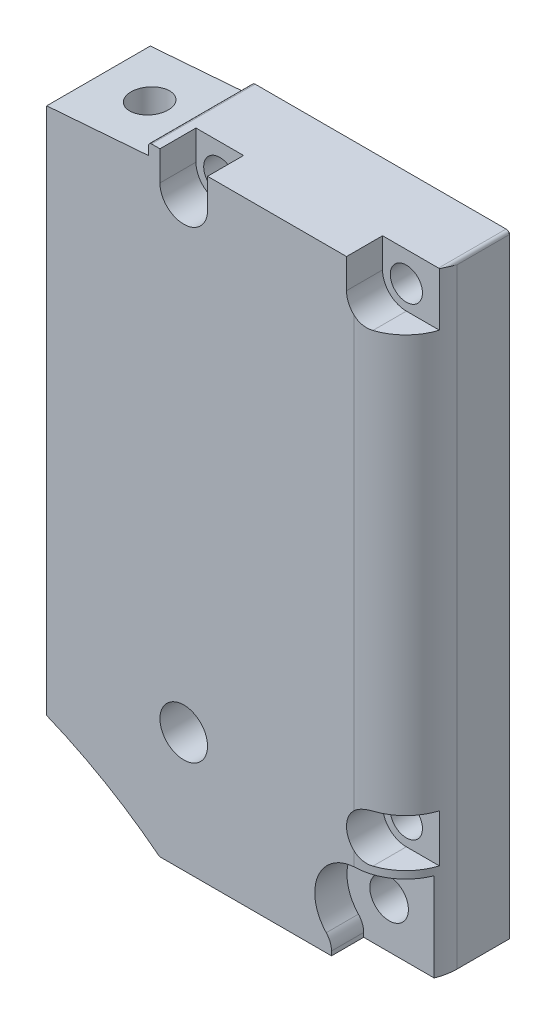
from build123d import *

# Parameters (mm, degrees)
SKETCH2_W                 = 20
SKETCH2_H                 = 40.65
BOSS_EXTRUDE2_DEPTH       = 7.05
SKETCH3_W                 = 18.2
SKETCH3_H                 = 38.65
BOSS_EXTRUDE3_DEPTH       = 0.9
CUT_EXTRUDE1_DEPTH        = 7
CUT_EXTRUDE4_REACH        = 40.342
SKETCH4_4_R               = 1.25
BOSS_EXTRUDE4_START       = 1
BOSS_EXTRUDE4_DEPTH       = 1
CUT_EXTRUDE5_START        = -1.8
SKETCH5_R                 = 1.85
SKETCH5_R_2               = 1.25
CUT_EXTRUDE5_DEPTH        = 1.8
CUT_EXTRUDE6_DEPTH        = 7.05
CUT_EXTRUDE7_REACH        = 161.774
SKETCH8_W                 = 5
SKETCH8_H                 = 4.55
SKETCH9_R                 = 1.85
BOSS_EXTRUDE5_DEPTH       = 1
BOSS_EXTRUDE7_DEPTH       = 8.05
CUT_EXTRUDE8_START        = -7
SKETCH12_W                = 8.257782219
SKETCH12_H                = 4.906896877
CUT_EXTRUDE8_DEPTH        = 7
CUT_EXTRUDE9_DEPTH        = 2.5
CUT_EXTRUDE10_START       = -8.05
SKETCH13_3_R              = 1.499999995
CUT_EXTRUDE10_DEPTH       = 5.55
CUT_EXTRUDE11_START       = 3.965472269
CUT_EXTRUDE11_DEPTH       = 15.412425263
CUT_EXTRUDE11_START_2     = -3.484925616
CUT_EXTRUDE11_2_OUTLINE_W = 6
CUT_EXTRUDE11_2_OUTLINE_H = 6
CUT_EXTRUDE11_2_DEPTH     = 1.484925616
FILLET1_START             = -28
FILLET1_DEPTH             = 48.269968213
FILLET2_R                 = 1.5


with BuildPart() as part:
    # Sketch2 → Boss-Extrude2 (new body)
    with BuildSketch(Plane.XY.offset(150.825691762)):
        with Locations((21.495324698, -0.04622899)):
            Rectangle(SKETCH2_W, SKETCH2_H)
    extrude(amount=-BOSS_EXTRUDE2_DEPTH)

    # Sketch3 → Boss-Extrude3 (add)
    with BuildSketch(Plane.XY.offset(150.825691762)):
        with Locations((21.495324698, -0.04622899)):
            Rectangle(SKETCH3_W, SKETCH3_H)
    extrude(amount=BOSS_EXTRUDE3_DEPTH)

    # Sketch4 → Cut-Extrude1 (cut)
    with BuildSketch(Plane.XY.offset(151.725691762)):
        with BuildLine():
            Line((29.995324698, -15.734564701), (29.995324698, 7.977115044))
            ThreePointArc((29.995324698, 7.977115044), (21.495324698, 1.30377101), (12.995324698, 7.977115044))
            Line((12.995324698, 7.977115044), (12.995324698, -15.734564701))
            ThreePointArc((12.995324698, -15.734564701), (15.847276575, -15.960245764), (16.832190562, -18.64622899))
            Line((16.832190562, -18.64622899), (26.158458833, -18.64622899))
            ThreePointArc((26.158458833, -18.64622899), (27.14337282, -15.960245764), (29.995324698, -15.734564701))
        make_face()
        with BuildLine():
            Line((29.995324698, 7.977115044), (29.995324698, 12.130426976))
            ThreePointArc((29.995324698, 12.130426976), (27.682509033, 16.240955345), (23.571980663, 18.55377101))
            Line((23.571980663, 18.55377101), (19.418668732, 18.55377101))
            ThreePointArc((19.418668732, 18.55377101), (15.308140362, 16.240955345), (12.995324698, 12.130426976))
            Line((12.995324698, 12.130426976), (12.995324698, 7.977115044))
            ThreePointArc((12.995324698, 7.977115044), (21.495324698, 1.30377101), (29.995324698, 7.977115044))
        make_face()
        with BuildLine():
            ThreePointArc((12.995324698, 12.130426976), (15.308140362, 16.240955345), (19.418668732, 18.55377101))
            Line((19.418668732, 18.55377101), (18.693093444, 18.55377101))
            ThreePointArc((18.693093444, 18.55377101), (15.166719006, 16.382376702), (12.995324698, 12.856002264))
            Line((12.995324698, 12.856002264), (12.995324698, 12.130426976))
        make_face()
        with BuildLine():
            Line((19.418668732, 18.55377101), (23.571980663, 18.55377101))
            ThreePointArc((23.571980663, 18.55377101), (21.495324698, 18.80377101), (19.418668732, 18.55377101))
        make_face()
        with BuildLine():
            Line((29.995324698, 12.130426976), (29.995324698, 12.856002264))
            ThreePointArc((29.995324698, 12.856002264), (27.823930389, 16.382376702), (24.297555951, 18.55377101))
            Line((24.297555951, 18.55377101), (23.571980663, 18.55377101))
            ThreePointArc((23.571980663, 18.55377101), (27.682509033, 16.240955345), (29.995324698, 12.130426976))
        make_face()
        with BuildLine():
            ThreePointArc((12.995324698, 12.130426976), (12.745324698, 10.05377101), (12.995324698, 7.977115044))
            Line((12.995324698, 7.977115044), (12.995324698, 12.130426976))
        make_face()
        with BuildLine():
            ThreePointArc((30.245324698, 10.05377101), (30.182599875, 11.099596043), (29.995324698, 12.130426976))
            Line((29.995324698, 12.130426976), (29.995324698, 7.977115044))
            ThreePointArc((29.995324698, 7.977115044), (30.182599875, 9.007945977), (30.245324698, 10.05377101))
        make_face()
    extrude(amount=-CUT_EXTRUDE1_DEPTH, mode=Mode.SUBTRACT)

    # Sketch4<4> → Cut-Extrude4 (cut, up to next)
    with BuildSketch(Plane.XY.offset(151.725691762), mode=Mode.PRIVATE) as cut_extrude4_sk1:
        with BuildLine():
            ThreePointArc((29.855223342, -18.64622899), (29.959794398, -18.367140037), (29.995324698, -18.07122899))
            ThreePointArc((29.995324698, -18.07122899), (28.449413651, -16.85675929), (27.635426054, -18.64622899))
            Line((27.635426054, -18.64622899), (29.855223342, -18.64622899))
        make_face()
    cut_extrude4_tool1 = extrude(cut_extrude4_sk1.sketch, amount=-CUT_EXTRUDE4_REACH, mode=Mode.PRIVATE) & part.part
    # Sketch4<4> → Cut-Extrude4 (cut, up to next)
    with BuildSketch(Plane.XY.offset(151.725691762), mode=Mode.PRIVATE) as cut_extrude4_sk2:
        with BuildLine():
            Line((29.855223342, -18.64622899), (27.635426054, -18.64622899))
            ThreePointArc((27.635426054, -18.64622899), (28.745324698, -19.32122899), (29.855223342, -18.64622899))
        make_face()
    cut_extrude4_tool2 = extrude(cut_extrude4_sk2.sketch, amount=-CUT_EXTRUDE4_REACH, mode=Mode.PRIVATE) & part.part
    # Sketch4<4> → Cut-Extrude4 (cut, up to next)
    with BuildSketch(Plane.XY.offset(151.725691762), mode=Mode.PRIVATE) as cut_extrude4_sk3:
        with BuildLine():
            ThreePointArc((29.855223342, -18.64622899), (29.959794398, -18.367140037), (29.995324698, -18.07122899))
            ThreePointArc((29.995324698, -18.07122899), (28.449413651, -16.85675929), (27.635426054, -18.64622899))
            Line((27.635426054, -18.64622899), (29.855223342, -18.64622899))
        make_face()
    cut_extrude4_tool3 = extrude(cut_extrude4_sk3.sketch, amount=-CUT_EXTRUDE4_REACH, mode=Mode.PRIVATE) & part.part
    # Sketch4<4> → Cut-Extrude4 (cut, up to next)
    with BuildSketch(Plane.XY.offset(151.725691762), mode=Mode.PRIVATE) as cut_extrude4_sk4:
        with BuildLine():
            Line((29.855223342, -18.64622899), (27.635426054, -18.64622899))
            ThreePointArc((27.635426054, -18.64622899), (28.745324698, -19.32122899), (29.855223342, -18.64622899))
        make_face()
    cut_extrude4_tool4 = extrude(cut_extrude4_sk4.sketch, amount=-CUT_EXTRUDE4_REACH, mode=Mode.PRIVATE) & part.part
    # Sketch4<4> → Cut-Extrude4 (cut, up to next)
    with BuildSketch(Plane.XY.offset(151.725691762), mode=Mode.PRIVATE) as cut_extrude4_sk5:
        with Locations((14.245324698, -18.07122899)):
            Circle(SKETCH4_4_R)
    cut_extrude4_tool5 = extrude(cut_extrude4_sk5.sketch, amount=-CUT_EXTRUDE4_REACH, mode=Mode.PRIVATE) & part.part
    # Sketch4<4> → Cut-Extrude4 (cut, up to next)
    with BuildSketch(Plane.XY.offset(151.725691762), mode=Mode.PRIVATE) as cut_extrude4_sk6:
        with Locations((28.745324698, 17.97877101)):
            Circle(SKETCH4_4_R)
    cut_extrude4_tool6 = extrude(cut_extrude4_sk6.sketch, amount=-CUT_EXTRUDE4_REACH, mode=Mode.PRIVATE) & part.part
    # Sketch4<4> → Cut-Extrude4 (cut, up to next)
    with BuildSketch(Plane.XY.offset(151.725691762), mode=Mode.PRIVATE) as cut_extrude4_sk7:
        with Locations((14.245324698, 17.97877101)):
            Circle(SKETCH4_4_R)
    cut_extrude4_tool7 = extrude(cut_extrude4_sk7.sketch, amount=-CUT_EXTRUDE4_REACH, mode=Mode.PRIVATE) & part.part
    add(cut_extrude4_tool1.solids().sort_by_distance((28.745325, -17.833823, 151.725692))[0], mode=Mode.SUBTRACT)
    add(cut_extrude4_tool2.solids().sort_by_distance((28.745325, -18.923652, 151.725692))[0], mode=Mode.SUBTRACT)
    add(cut_extrude4_tool3.solids().sort_by_distance((28.745325, -17.833823, 151.725692))[0], mode=Mode.SUBTRACT)
    add(cut_extrude4_tool4.solids().sort_by_distance((28.745325, -18.923652, 151.725692))[0], mode=Mode.SUBTRACT)
    add(cut_extrude4_tool5.solids().sort_by_distance((14.245325, -18.071229, 151.725692))[0], mode=Mode.SUBTRACT)
    add(cut_extrude4_tool6.solids().sort_by_distance((28.745325, 17.978771, 151.725692))[0], mode=Mode.SUBTRACT)
    add(cut_extrude4_tool7.solids().sort_by_distance((14.245325, 17.978771, 151.725692))[0], mode=Mode.SUBTRACT)

    # Sketch6 → Boss-Extrude4 (add)
    with BuildSketch(Plane.XY.offset(144.725691762).offset(BOSS_EXTRUDE4_START)):
        with BuildLine():
            ThreePointArc((13.658334388, 14.376279875), (16.709025437, 15.285691236), (17.885705242, 18.243590751))
            ThreePointArc((17.885705242, 18.243590751), (15.454195488, 16.657350181), (13.658334388, 14.376279875))
        make_face()
        with BuildLine():
            ThreePointArc((17.849749062, -18.64622899), (16.56791041, -15.255541577), (12.995324698, -14.64194335))
            Line((12.995324698, -14.64194335), (12.995324698, -15.734564701))
            ThreePointArc((12.995324698, -15.734564701), (15.847276575, -15.960245764), (16.832190562, -18.64622899))
            Line((16.832190562, -18.64622899), (17.849749062, -18.64622899))
        make_face()
        with BuildLine():
            ThreePointArc((29.332315007, 14.376279875), (27.536453908, 16.657350181), (25.104944154, 18.243590751))
            ThreePointArc((25.104944154, 18.243590751), (26.281623958, 15.285691236), (29.332315007, 14.376279875))
        make_face()
        with BuildLine():
            ThreePointArc((29.995324698, -14.64194335), (26.422738985, -15.255541577), (25.140900333, -18.64622899))
            Line((25.140900333, -18.64622899), (26.158458833, -18.64622899))
            ThreePointArc((26.158458833, -18.64622899), (27.14337282, -15.960245764), (29.995324698, -15.734564701))
            Line((29.995324698, -15.734564701), (29.995324698, -14.64194335))
        make_face()
    extrude(amount=-BOSS_EXTRUDE4_DEPTH)

    # Sketch5 → Cut-Extrude5 (cut)
    # profile 1 of 7: a face of its own
    with BuildSketch(Plane(origin=(0, 0, 143.775691762), x_dir=(-1, 0, 0), z_dir=(0, 0, -1)).offset(CUT_EXTRUDE5_START)):
        with BuildLine():
            Line((-31.495324698, 16.12877101), (-28.745324698, 16.12877101))
            ThreePointArc((-28.745324698, 16.12877101), (-30.053472243, 19.286918555), (-26.895324698, 17.97877101))
            Line((-26.895324698, 17.97877101), (-26.895324698, 20.27877101))
            Line((-26.895324698, 20.27877101), (-31.495324698, 20.27877101))
            Line((-31.495324698, 20.27877101), (-31.495324698, 16.12877101))
        make_face()
    # profile 2 of 7: a face of its own
    with BuildSketch(Plane(origin=(0, 0, 143.775691762), x_dir=(-1, 0, 0), z_dir=(0, 0, -1)).offset(CUT_EXTRUDE5_START)):
        with Locations((-28.745324698, 17.97877101)):
            Circle(SKETCH5_R)
        with Locations(Location((-28.745324698, 17.97877101, 0), (0, 0, 180))):
            Circle(SKETCH5_R_2, mode=Mode.SUBTRACT)
    # profile 3 of 7: a face of its own
    with BuildSketch(Plane(origin=(0, 0, 143.775691762), x_dir=(-1, 0, 0), z_dir=(0, 0, -1)).offset(CUT_EXTRUDE5_START)):
        with BuildLine():
            Line((-12.395324698, 20.27877101), (-16.095324698, 20.27877101))
            Line((-16.095324698, 20.27877101), (-16.095324698, 17.97877101))
            ThreePointArc((-16.095324698, 17.97877101), (-14.245324698, 19.82877101), (-12.395324698, 17.97877101))
            Line((-12.395324698, 17.97877101), (-12.395324698, 20.27877101))
        make_face()
    # profile 4 of 7: a face of its own
    with BuildSketch(Plane(origin=(0, 0, 143.775691762), x_dir=(-1, 0, 0), z_dir=(0, 0, -1)).offset(CUT_EXTRUDE5_START)):
        with Locations((-14.245324698, 17.97877101)):
            Circle(SKETCH5_R)
        with Locations(Location((-14.245324698, 17.97877101, 0), (0, 0, 180))):
            Circle(SKETCH5_R_2, mode=Mode.SUBTRACT)
    # profile 5 of 7: a face of its own
    with BuildSketch(Plane(origin=(0, 0, 143.775691762), x_dir=(-1, 0, 0), z_dir=(0, 0, -1)).offset(CUT_EXTRUDE5_START)):
        with BuildLine():
            Line((-28.745324698, -16.22122899), (-31.495324698, -16.22122899))
            Line((-31.495324698, -16.22122899), (-31.495324698, -19.92122899))
            Line((-31.495324698, -19.92122899), (-28.745324698, -19.92122899))
            ThreePointArc((-28.745324698, -19.92122899), (-30.595324698, -18.07122899), (-28.745324698, -16.22122899))
        make_face()
    # profile 6 of 7: a face of its own
    with BuildSketch(Plane(origin=(0, 0, 143.775691762), x_dir=(-1, 0, 0), z_dir=(0, 0, -1)).offset(CUT_EXTRUDE5_START)):
        with Locations((-28.745324698, -18.07122899)):
            Circle(SKETCH5_R)
        with Locations(Location((-28.745324698, -18.07122899, 0), (0, 0, 180))):
            Circle(SKETCH5_R_2, mode=Mode.SUBTRACT)
    # profile 7 of 7: a face of its own
    with BuildSketch(Plane(origin=(0, 0, 143.775691762), x_dir=(-1, 0, 0), z_dir=(0, 0, -1)).offset(CUT_EXTRUDE5_START)):
        with Locations((-14.245324698, -18.07122899)):
            Circle(SKETCH5_R)
        with Locations(Location((-14.245324698, -18.07122899, 0), (0, 0, 180))):
            Circle(SKETCH5_R_2, mode=Mode.SUBTRACT)
    extrude(amount=CUT_EXTRUDE5_DEPTH, mode=Mode.SUBTRACT)

    # Sketch7 → Cut-Extrude6 (cut)
    with BuildSketch(Plane(origin=(0, 0, 143.775691762), x_dir=(-1, 0, 0), z_dir=(0, 0, -1))):
        with BuildLine():
            Line((-31.495324698, -20.37122899), (-31.245324698, -20.37122899))
            ThreePointArc((-31.245324698, -20.37122899), (-31.422101393, -20.298005685), (-31.495324698, -20.12122899))
            Line((-31.495324698, -20.12122899), (-31.495324698, -20.37122899))
        make_face()
        with BuildLine():
            Line((-11.745324698, -20.37122899), (-11.495324698, -20.37122899))
            Line((-11.495324698, -20.37122899), (-11.495324698, -20.12122899))
            ThreePointArc((-11.495324698, -20.12122899), (-11.568548002, -20.298005685), (-11.745324698, -20.37122899))
        make_face()
        with BuildLine():
            ThreePointArc((-11.745324698, 20.27877101), (-11.568548002, 20.205547705), (-11.495324698, 20.02877101))
            Line((-11.495324698, 20.02877101), (-11.495324698, 20.27877101))
            Line((-11.495324698, 20.27877101), (-11.745324698, 20.27877101))
        make_face()
        with BuildLine():
            ThreePointArc((-31.245324698, 20.27877101), (-31.422101393, 20.205547705), (-31.495324698, 20.02877101))
            Line((-31.495324698, 20.02877101), (-31.495324698, 20.27877101))
            Line((-31.495324698, 20.27877101), (-31.245324698, 20.27877101))
        make_face()
    extrude(amount=-CUT_EXTRUDE6_DEPTH, mode=Mode.SUBTRACT)

    # Sketch8 → Cut-Extrude7 (cut, up to next)
    with BuildSketch(Plane(origin=(0, -18.64622899, 0), x_dir=(1, 0, 0), z_dir=(0, 1, 0)), mode=Mode.PRIVATE) as cut_extrude7_sk1:
        with Locations((21.495324698, -149.450691762)):
            Rectangle(SKETCH8_W, SKETCH8_H)
    cut_extrude7_tool1 = extrude(cut_extrude7_sk1.sketch, amount=-CUT_EXTRUDE7_REACH, mode=Mode.PRIVATE) & part.part
    add(cut_extrude7_tool1.solids().sort_by_distance((21.495325, -18.646229, 149.450692))[0], mode=Mode.SUBTRACT)

    # Sketch9 → Boss-Extrude5 (add)
    with BuildSketch(Plane(origin=(0, 0, 143.775691762), x_dir=(-1, 0, 0), z_dir=(0, 0, -1))):
        with BuildLine():
            ThreePointArc((-11.745324698, -20.37122899), (-11.568548002, -20.298005685), (-11.495324698, -20.12122899))
            Line((-11.495324698, -20.12122899), (-11.495324698, 20.02877101))
            ThreePointArc((-11.495324698, 20.02877101), (-11.568548002, 20.205547705), (-11.745324698, 20.27877101))
            Line((-11.745324698, 20.27877101), (-12.395324698, 20.27877101))
            Line((-12.395324698, 20.27877101), (-12.395324698, 17.97877101))
            ThreePointArc((-12.395324698, 17.97877101), (-14.245324698, 16.12877101), (-16.095324698, 17.97877101))
            Line((-16.095324698, 17.97877101), (-16.095324698, 20.27877101))
            Line((-16.095324698, 20.27877101), (-26.895324698, 20.27877101))
            Line((-26.895324698, 20.27877101), (-26.895324698, 17.97877101))
            ThreePointArc((-26.895324698, 17.97877101), (-27.437177152, 16.670623465), (-28.745324698, 16.12877101))
            Line((-28.745324698, 16.12877101), (-31.495324698, 16.12877101))
            Line((-31.495324698, 16.12877101), (-31.495324698, -16.22122899))
            Line((-31.495324698, -16.22122899), (-28.745324698, -16.22122899))
            ThreePointArc((-28.745324698, -16.22122899), (-26.895324698, -18.07122899), (-28.745324698, -19.92122899))
            Line((-28.745324698, -19.92122899), (-31.495324698, -19.92122899))
            Line((-31.495324698, -19.92122899), (-31.495324698, -20.12122899))
            ThreePointArc((-31.495324698, -20.12122899), (-31.422101393, -20.298005685), (-31.245324698, -20.37122899))
            Line((-31.245324698, -20.37122899), (-11.745324698, -20.37122899))
        make_face()
        with Locations((-14.245324698, -18.07122899)):
            Circle(SKETCH9_R, mode=Mode.SUBTRACT)
    extrude(amount=BOSS_EXTRUDE5_DEPTH)

    # Sketch11 → Boss-Extrude7 (add)
    with BuildSketch(Plane(origin=(0, 0, 142.775691762), x_dir=(-1, 0, 0), z_dir=(0, 0, -1))):
        with BuildLine():
            ThreePointArc((-12.363529237, -27.37122899), (-11.931858956, -27.037692554), (-11.495324698, -26.710547897))
            Line((-11.495324698, -26.710547897), (-11.495324698, -20.12122899))
            ThreePointArc((-11.495324698, -20.12122899), (-11.568548002, -20.298005685), (-11.745324698, -20.37122899))
            Line((-11.745324698, -20.37122899), (-31.245324698, -20.37122899))
            ThreePointArc((-31.245324698, -20.37122899), (-31.422101393, -20.298005685), (-31.495324698, -20.12122899))
            Line((-31.495324698, -20.12122899), (-31.495324698, -27.37122899))
            Line((-31.495324698, -27.37122899), (-12.363529237, -27.37122899))
        make_face()
        with BuildLine():
            ThreePointArc((-11.495324698, -26.710547897), (-7.682005328, -24.242455478), (-3.595324698, -22.259546951))
            Line((-3.595324698, -22.259546951), (-3.595324698, 18.771265769))
            Line((-3.595324698, 18.771265769), (-11.495324698, 19.377897532))
            Line((-11.495324698, 19.377897532), (-11.495324698, -20.12122899))
            Line((-11.495324698, -20.12122899), (-11.495324698, -26.710547897))
        make_face()
    extrude(amount=-BOSS_EXTRUDE7_DEPTH)

    # Sketch12 → Cut-Extrude8 (cut)
    with BuildSketch(Plane.XZ.offset(27.37122899).offset(CUT_EXTRUDE8_START)):
        with Locations((21.495324698, 148.372243324)):
            Rectangle(SKETCH12_W, SKETCH12_H)
    extrude(amount=CUT_EXTRUDE8_DEPTH, mode=Mode.SUBTRACT)

    # Sketch13 → Cut-Extrude9 (cut)
    with BuildSketch(Plane(origin=(0, 0, 142.775691762), x_dir=(-1, 0, 0), z_dir=(0, 0, -1))):
        with BuildLine():
            Line((-25.728428709, -27.37122899), (-25.728428709, -26.381755197))
            ThreePointArc((-25.728428712, -26.381755192), (-24.598475851, -22.727703268), (-27.703428709, -20.494285107))
            Line((-27.703428709, -20.494285101), (-31.495324698, -20.494285101))
            Line((-31.495324698, -20.494285101), (-31.495324698, -27.37122899))
            Line((-31.495324698, -27.37122899), (-25.728428709, -27.37122899))
        make_face()
    extrude(amount=-CUT_EXTRUDE9_DEPTH, mode=Mode.SUBTRACT)

    # Sketch13<3> → Cut-Extrude10 (cut)
    with BuildSketch(Plane(origin=(0, 0, 142.775691762), x_dir=(-1, 0, 0), z_dir=(0, 0, -1)).offset(CUT_EXTRUDE10_START)):
        with Locations((-27.703428709, -23.769285101)):
            Circle(SKETCH13_3_R)
    extrude(amount=CUT_EXTRUDE10_DEPTH, mode=Mode.SUBTRACT)

    # Cut-Extrude11: read off the stored shape, not the designer's step
    # Cut-Extrude11 outline → Cut-Extrude11 (cut)
    with BuildSketch(Plane(origin=(0, 0, 0), x_dir=(1, 0, 0), z_dir=(0, 1, 0)).offset(CUT_EXTRUDE11_START)):
        with BuildLine():
            add(Edge.make_bspline(
                [(6.124424281, -146.800691762), (6.124424281, -149.312165433), (8.293040031, -148.056428598), (10.46165578, -146.800691762), (8.293040031, -145.544954927), (6.124424281, -144.289218091), (6.124424281, -146.800691762)],
                knots=[0, 0, 0, 2.094395102, 2.094395102, 4.188790205, 4.188790205, 6.283185307, 6.283185307, 6.283185307], degree=2, weights=[1, 0.5, 1, 0.5, 1, 0.5, 1]))
        make_face()
    extrude(amount=CUT_EXTRUDE11_DEPTH, mode=Mode.SUBTRACT)

    # Cut-Extrude11 2 outline → Cut-Extrude11 2 (add)
    with BuildSketch(Plane(origin=(0, 0, 0), x_dir=(0.997064712375443, 0.07656343341096303, 0), z_dir=(0.07656343341096301, -0.9970647123754431, 0)).offset(CUT_EXTRUDE11_START_2)):
        with Locations((8, 147)):
            Rectangle(CUT_EXTRUDE11_2_OUTLINE_W, CUT_EXTRUDE11_2_OUTLINE_H)
    extrude(amount=CUT_EXTRUDE11_2_DEPTH)

    # Fillet1: read off the stored shape, not the designer's step
    # Fillet1 outline → Fillet1 (cut)
    with BuildSketch(Plane(origin=(0, 0, 0), x_dir=(1, 0, 0), z_dir=(0, 1, 0)).offset(FILLET1_START)):
        with BuildLine():
            Line((31.495324698, -142.775691762), (27.495324698, -142.775691762))
            ThreePointArc((27.495324698, -142.775691762), (30.323751823, -143.947264638), (31.495324698, -146.775691762))
            Line((31.495324698, -146.775691762), (31.495324698, -142.775691762))
        make_face()
    extrude(amount=FILLET1_DEPTH, mode=Mode.SUBTRACT)

    # Fillet2
    fillet2_edges = [part.edges().sort_by_distance(p)[0] for p in [
        (25.728428711, -26.381755194, 144.025691762),
    ]]
    fillet(fillet2_edges, radius=FILLET2_R)


with BuildPart() as body_2:
    # Mirror1: mirrored copy
    add(part.part.mirror(Plane.XY.offset(151.725691762)))


solid = body_2.part
